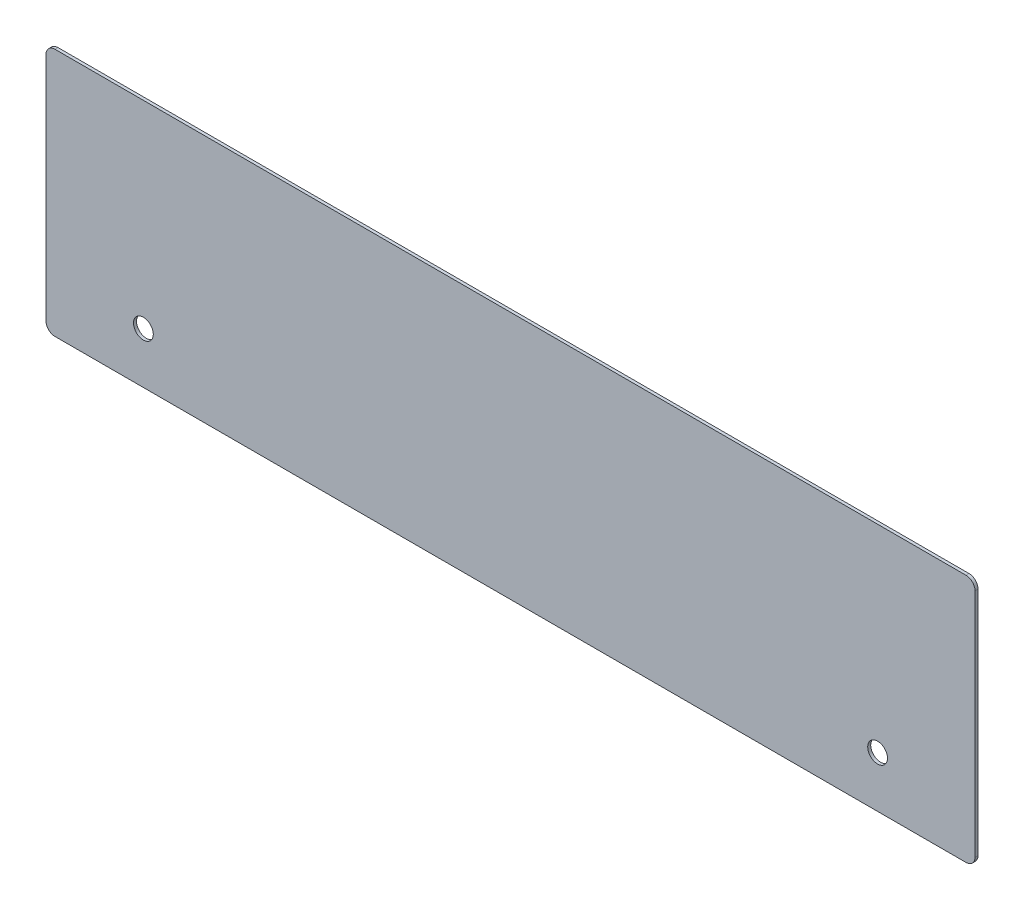
from build123d import *

# Parameters (mm, degrees)
SKETCH1_W          = 310
SKETCH1_H          = 83
BASE_FLANGE1_DEPTH = 1
FILLET1_R          = 3
SKETCH6_R          = 3.3
CUT_EXTRUDE1_DEPTH = 10


# Sheet-metal steps are written as plain solids
with BuildPart() as part:
    # Sketch1 → Base-Flange1 (new body)
    with BuildSketch(Plane.XY):
        Rectangle(SKETCH1_W, SKETCH1_H)
    extrude(amount=-BASE_FLANGE1_DEPTH)

    # Fillet1
    fillet1_edges = [part.edges().sort_by_distance(p)[0] for p in [
        (155, -41.5, -0.5),
        (-155, -41.5, -0.5),
        (-155, 41.5, -0.5),
        (155, 41.5, -0.5),
    ]]
    fillet(fillet1_edges, radius=FILLET1_R)

    # Sketch6 → Cut-Extrude1 (cut)
    with BuildSketch(Plane.XY):
        with Locations((122.5, -24.493378468)):
            Circle(SKETCH6_R)
        with Locations((-122.5, -24.493378468)):
            Circle(SKETCH6_R)
    extrude(amount=-CUT_EXTRUDE1_DEPTH, mode=Mode.SUBTRACT)


solid = part.part
